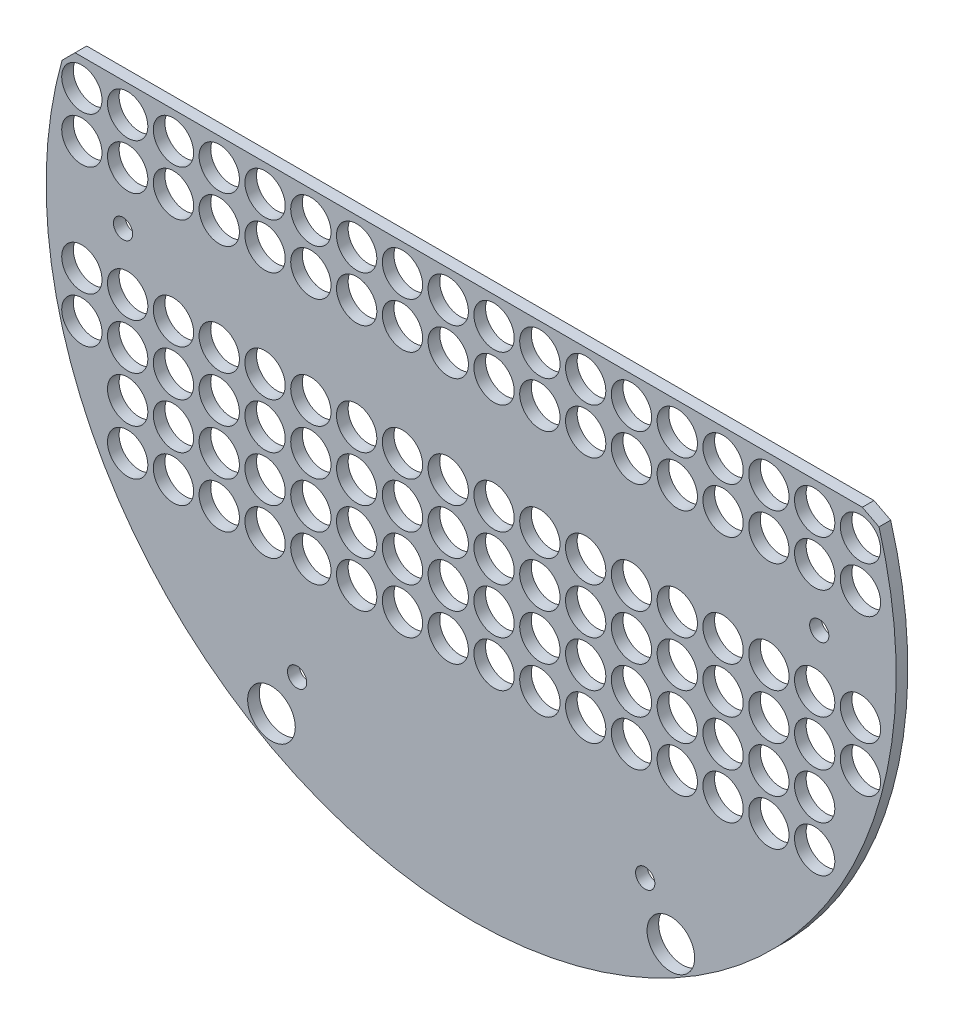
from build123d import *

# Parameters (mm, degrees)
BOSS_EXTRUDE1_DEPTH = 6.35
CHAMFER1_SIZE       = 5
CHAMFER1_SIZE_2     = 7.672581673
SKETCH2_R           = 5.25
CUT_EXTRUDE1_DEPTH  = 329.158989668
SKETCH3_R           = 11
CUT_EXTRUDE2_DEPTH  = 329.158989668
SKETCH4_R           = 13
CUT_EXTRUDE3_DEPTH  = 329.158989668


with BuildPart() as part:
    # Sketch1 → Boss-Extrude1 (new body)
    with BuildSketch(Plane.XY):
        with BuildLine():
            Line((-221.187703094, 70), (221.187703094, 70))
            ThreePointArc((221.187703094, 70), (0, -232), (-221.187703094, 70))
        make_face()
    extrude(amount=BOSS_EXTRUDE1_DEPTH)

    # Chamfer1
    # the kernel refuses this chamfer: 7.672581673, 5 mm, written as the material it takes off along each edge
    with BuildSketch(Plane(origin=(-221.187703094, 70, -19.287514673), x_dir=(1, 0, 0), z_dir=(0, 0, 1))) as chamfer1_piece_1:
        with BuildLine():
            Line((CHAMFER1_SIZE, 0), (-2.131765618, -7.131765618))
            ThreePointArc((-2.131765618, -7.131765618), (-1.133115382, -3.68670064), (0, 0))
            Line((0, 0), (CHAMFER1_SIZE, 0))
        make_face()
    extrude(amount=44.925029345, mode=Mode.SUBTRACT)
    with BuildSketch(Plane(origin=(221.187703094, 70, -19.865544851), x_dir=(-1, 0, 0), z_dir=(0, 0, 1))) as chamfer1_piece_2:
        with BuildLine():
            Line((CHAMFER1_SIZE_2, 0), (-1.44240767, 4.732597867))
            ThreePointArc((-1.44240767, 4.732597867), (-0.765078162, 2.465098705), (0, 0))
            Line((0, 0), (CHAMFER1_SIZE_2, 0))
        make_face()
    extrude(amount=46.081089702, mode=Mode.SUBTRACT)

    # Sketch2 → Cut-Extrude1 (cut, through all)
    with BuildSketch(Plane.XY.offset(6.35)):
        with Locations((-190, 0)):
            Circle(SKETCH2_R)
        with Locations((190, 0)):
            Circle(SKETCH2_R)
        with Locations((95, -164.544826719)):
            Circle(SKETCH2_R)
        with Locations((-95, -164.544826719)):
            Circle(SKETCH2_R)
    extrude(amount=-CUT_EXTRUDE1_DEPTH, mode=Mode.SUBTRACT)

    # Sketch3 → Cut-Extrude2 (cut, through all)
    with BuildSketch(Plane.XY.offset(6.35)):
        with Locations((12.5, -30)):
            Circle(SKETCH3_R)
        with Locations((12.5, -55)):
            Circle(SKETCH3_R)
        with Locations((12.5, -80)):
            Circle(SKETCH3_R)
        with Locations((12.5, -105)):
            Circle(SKETCH3_R)
        with Locations((37.5, -30)):
            Circle(SKETCH3_R)
        with Locations((37.5, -55)):
            Circle(SKETCH3_R)
        with Locations((62.5, -30)):
            Circle(SKETCH3_R)
        with Locations((62.5, -55)):
            Circle(SKETCH3_R)
        with Locations((87.5, -30)):
            Circle(SKETCH3_R)
        with Locations((87.5, -55)):
            Circle(SKETCH3_R)
        with Locations((112.5, -30)):
            Circle(SKETCH3_R)
        with Locations((112.5, -55)):
            Circle(SKETCH3_R)
        with Locations((137.5, -30)):
            Circle(SKETCH3_R)
        with Locations((137.5, -55)):
            Circle(SKETCH3_R)
        with Locations((162.5, -30)):
            Circle(SKETCH3_R)
        with Locations((162.5, -55)):
            Circle(SKETCH3_R)
        with Locations((187.5, -30)):
            Circle(SKETCH3_R)
        with Locations((187.5, -55)):
            Circle(SKETCH3_R)
        with Locations((212.5, -30)):
            Circle(SKETCH3_R)
        with Locations((212.5, -55)):
            Circle(SKETCH3_R)
        with Locations((37.5, -80)):
            Circle(SKETCH3_R)
        with Locations((37.5, -105)):
            Circle(SKETCH3_R)
        with Locations((62.5, -80)):
            Circle(SKETCH3_R)
        with Locations((62.5, -105)):
            Circle(SKETCH3_R)
        with Locations((87.5, -80)):
            Circle(SKETCH3_R)
        with Locations((87.5, -105)):
            Circle(SKETCH3_R)
        with Locations((112.5, -80)):
            Circle(SKETCH3_R)
        with Locations((112.5, -105)):
            Circle(SKETCH3_R)
        with Locations((137.5, -80)):
            Circle(SKETCH3_R)
        with Locations((137.5, -105)):
            Circle(SKETCH3_R)
        with Locations((162.5, -80)):
            Circle(SKETCH3_R)
        with Locations((162.5, -105)):
            Circle(SKETCH3_R)
        with Locations((187.5, -80)):
            Circle(SKETCH3_R)
        with Locations((187.5, -105)):
            Circle(SKETCH3_R)
        with Locations((12.5, 30)):
            Circle(SKETCH3_R)
        with Locations((12.5, 55)):
            Circle(SKETCH3_R)
        with Locations((37.5, 55)):
            Circle(SKETCH3_R)
        with Locations((37.5, 30)):
            Circle(SKETCH3_R)
        with Locations((62.5, 55)):
            Circle(SKETCH3_R)
        with Locations((62.5, 30)):
            Circle(SKETCH3_R)
        with Locations((87.5, 55)):
            Circle(SKETCH3_R)
        with Locations((87.5, 30)):
            Circle(SKETCH3_R)
        with Locations((112.5, 55)):
            Circle(SKETCH3_R)
        with Locations((112.5, 30)):
            Circle(SKETCH3_R)
        with Locations((137.5, 55)):
            Circle(SKETCH3_R)
        with Locations((137.5, 30)):
            Circle(SKETCH3_R)
        with Locations((162.5, 55)):
            Circle(SKETCH3_R)
        with Locations((162.5, 30)):
            Circle(SKETCH3_R)
        with Locations((187.5, 55)):
            Circle(SKETCH3_R)
        with Locations((187.5, 30)):
            Circle(SKETCH3_R)
        with Locations((212.5, 55)):
            Circle(SKETCH3_R)
        with Locations((212.5, 30)):
            Circle(SKETCH3_R)
    cut_extrude2 = extrude(amount=-CUT_EXTRUDE2_DEPTH, mode=Mode.SUBTRACT)

    # Mirror2: Cut-Extrude2 across plane
    add(cut_extrude2.mirror(Plane(origin=(0, 0, 0), x_dir=(0, 0, 1), z_dir=(1, 0, 0))), mode=Mode.SUBTRACT)

    # Sketch4 → Cut-Extrude3 (cut, through all)
    with BuildSketch(Plane.XY.offset(6.35)):
        with Locations((-109, -188.793538025)):
            Circle(SKETCH4_R)
        with Locations((109, -188.793538025)):
            Circle(SKETCH4_R)
    extrude(amount=-CUT_EXTRUDE3_DEPTH, mode=Mode.SUBTRACT)


solid = part.part
